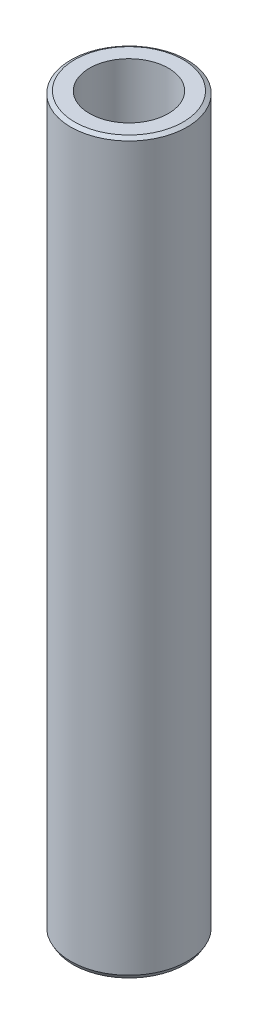
from build123d import *
from OCP.BRepFilletAPI import BRepFilletAPI_MakeChamfer

# Parameters (mm, degrees)
SKETCH1_R           = 47.5
BOSS_EXTRUDE1_DEPTH = 594.970153597
SKETCH2_R           = 32.167816369
CUT_EXTRUDE1_DEPTH  = 599.750351709
CHAMFER1_SIZE       = 1.895133248
CHAMFER1_SIZE2      = 3.282467073


with BuildPart() as part:
    # Sketch1 → Boss-Extrude1 (new body)
    with BuildSketch(Plane(origin=(0, 0, 0), x_dir=(1, 0, 0), z_dir=(0, 1, 0))):
        Circle(SKETCH1_R)
    extrude(amount=BOSS_EXTRUDE1_DEPTH)

    # Sketch2 → Cut-Extrude1 (cut, through all)
    with BuildSketch(Plane(origin=(0, 0, 0), x_dir=(1, 0, 0), z_dir=(0, 1, 0))):
        Circle(SKETCH2_R)
    extrude(amount=CUT_EXTRUDE1_DEPTH, mode=Mode.SUBTRACT)

    # Chamfer1: one chamfer whose edges measure the first distance from different faces: ONE call of the kernel's chamfer builder (chamfer() names one face for all edges)
    chamfer1_edges_1 = [part.edges().sort_by_distance(p)[0] for p in [
        (-47.5, 594.970153597, 0),
    ]]
    chamfer1_side_1 = [part.faces().sort_by_distance(p)[0] for p in [
        (-47.5, 297.485076798, 0),
    ]]
    chamfer1_edges_2 = [part.edges().sort_by_distance(p)[0] for p in [
        (-47.5, 0, 0),
    ]]
    chamfer1_side_2 = [part.faces().sort_by_distance(p)[0] for p in [
        (-46.156497116, 0, 0),
    ]]
    chamfer1 = BRepFilletAPI_MakeChamfer(part.part.solid().wrapped)
    for e in chamfer1_edges_1:
        chamfer1.Add(CHAMFER1_SIZE, CHAMFER1_SIZE2, e.wrapped, chamfer1_side_1[0].wrapped)  # the first distance lies on this face
    for e in chamfer1_edges_2:
        chamfer1.Add(CHAMFER1_SIZE, CHAMFER1_SIZE2, e.wrapped, chamfer1_side_2[0].wrapped)  # the first distance lies on this face
    add(Compound.cast(chamfer1.Shape()), mode=Mode.REPLACE)


solid = part.part
